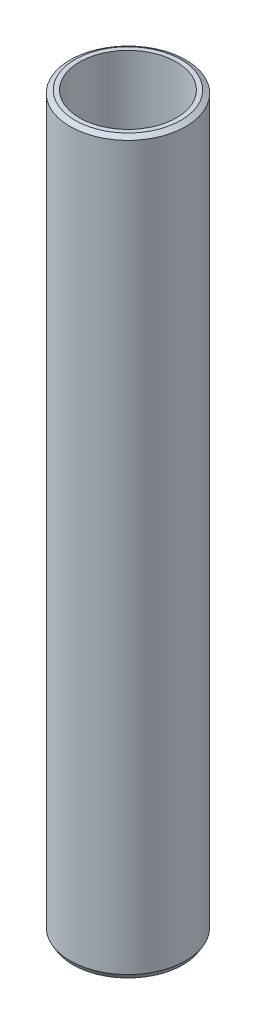
from build123d import *
from OCP.BRepFilletAPI import BRepFilletAPI_MakeChamfer

# Parameters (mm, degrees)
SKETCH1_R           = 47.5
BOSS_EXTRUDE1_DEPTH = 600
SKETCH2_R           = 39.80321137
CUT_EXTRUDE1_DEPTH  = 604.748706003
CHAMFER1_SIZE       = 2.352939905
CHAMFER1_SIZE2      = 4.075411463


with BuildPart() as part:
    # Sketch1 → Boss-Extrude1 (new body)
    with BuildSketch(Plane(origin=(0, 0, 0), x_dir=(1, 0, 0), z_dir=(0, 1, 0))):
        Circle(SKETCH1_R)
    extrude(amount=BOSS_EXTRUDE1_DEPTH)

    # Sketch2 → Cut-Extrude1 (cut, through all)
    with BuildSketch(Plane(origin=(0, 0, 0), x_dir=(1, 0, 0), z_dir=(0, 1, 0))):
        Circle(SKETCH2_R)
    extrude(amount=CUT_EXTRUDE1_DEPTH, mode=Mode.SUBTRACT)

    # Chamfer1: one chamfer whose edges measure the first distance from different faces: ONE call of the kernel's chamfer builder (chamfer() names one face for all edges)
    chamfer1_edges_1 = [part.edges().sort_by_distance(p)[0] for p in [
        (-47.5, 600, 0),
    ]]
    chamfer1_side_1 = [part.faces().sort_by_distance(p)[0] for p in [
        (-47.5, 300, 0),
    ]]
    chamfer1_edges_2 = [part.edges().sort_by_distance(p)[0] for p in [
        (-47.5, 0, 0),
    ]]
    chamfer1_side_2 = [part.faces().sort_by_distance(p)[0] for p in [
        (-46.156497116, 0, 0),
    ]]
    chamfer1 = BRepFilletAPI_MakeChamfer(part.part.solid().wrapped)
    for e in chamfer1_edges_1:
        chamfer1.Add(CHAMFER1_SIZE, CHAMFER1_SIZE2, e.wrapped, chamfer1_side_1[0].wrapped)  # the first distance lies on this face
    for e in chamfer1_edges_2:
        chamfer1.Add(CHAMFER1_SIZE, CHAMFER1_SIZE2, e.wrapped, chamfer1_side_2[0].wrapped)  # the first distance lies on this face
    add(Compound.cast(chamfer1.Shape()), mode=Mode.REPLACE)


solid = part.part
